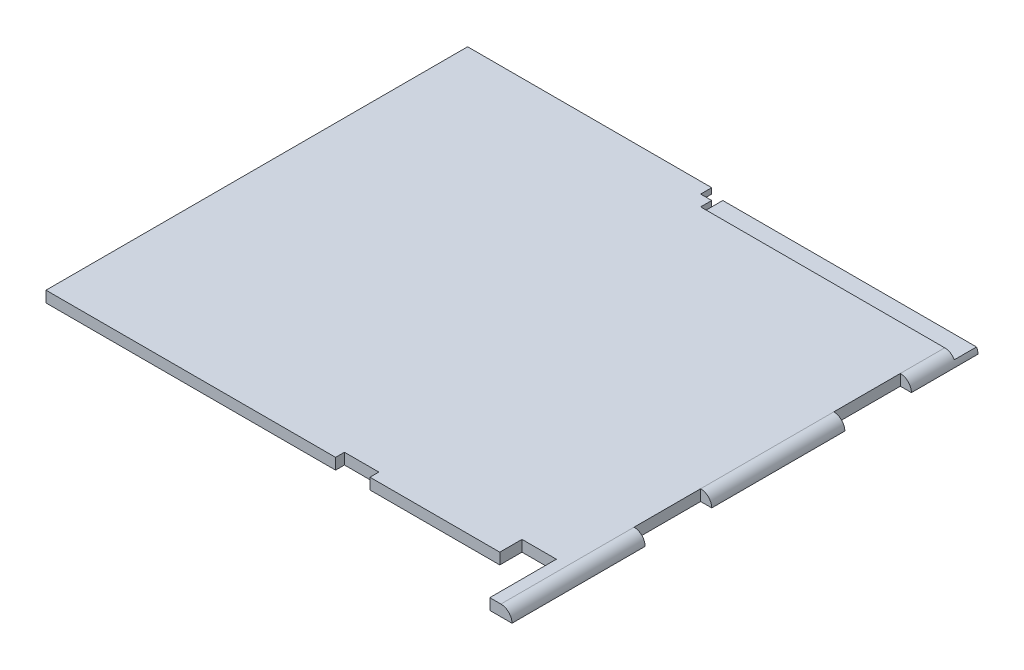
from build123d import *

# Parameters (mm, degrees)
SKETCH_1_W          = 5
SKETCH_1_H          = 60
SKETCH_1_W_2        = 30
SKETCH_1_H_2        = 5
SKETCH_1_W_3        = 15
EXTRUDE_1_DEPTH     = 5
FILLET_1_R          = 5
SKETCH_2_W          = 245
SKETCH_2_H          = 125
CUT_EXTRUDE_1_DEPTH = 5
SKETCH_3_W          = 110
SKETCH_3_H          = 2.5
SKETCH_3_W_2        = 115
CUT_EXTRUDE_2_DEPTH = 10
SKETCH_4_W          = 5
SKETCH_4_H          = 5
CUT_EXTRUDE_3_DEPTH = 5


with BuildPart() as part:
    # 草圖1 → 填料-伸長1 (new body)
    with BuildSketch(Plane(origin=(0, 0, 0), x_dir=(1, 0, 0), z_dir=(0, 1, 0))):
        Polygon((198.746286718, -286.464902661), (198.746286718, -256.464902661), (183.246286718, -256.464902661), (183.246286718, -266.464902661), (124.746286718, -266.464902661), (124.746286718, -262.464902661), (109.246286718, -262.464902661), (109.246286718, -266.464902661), (-21.253713282, -266.464902661), (-21.253713282, 38.535097339), (-36.253713282, 38.535097339), (-36.253713282, 43.535097339), (203.746286718, 43.535097339), (203.746286718, -286.464902661), align=None)
        with Locations((206.246286718, -256.464902661)):
            Rectangle(SKETCH_1_W, SKETCH_1_H)
        with Locations((206.246286718, 13.535097339)):
            Rectangle(SKETCH_1_W, SKETCH_1_H)
        with Locations((188.746286718, 46.035097339)):
            Rectangle(SKETCH_1_W_2, SKETCH_1_H_2)
        with Locations((-21.253713282, 46.035097339)):
            Rectangle(SKETCH_1_W_2, SKETCH_1_H_2)
        with Locations((91.246286718, 46.035097339)):
            Rectangle(SKETCH_1_W_3, SKETCH_1_H_2)
        with Locations((76.246286718, 46.035097339)):
            Rectangle(SKETCH_1_W_3, SKETCH_1_H_2)
        with Locations((206.246286718, -166.464902661)):
            Rectangle(SKETCH_1_W, SKETCH_1_H)
        with Locations((206.246286718, -76.464902661)):
            Rectangle(SKETCH_1_W, SKETCH_1_H)
    extrude(amount=EXTRUDE_1_DEPTH)

    # 圓角1
    fillet_1_edges = [part.edges().sort_by_distance(p)[0] for p in [
        (208.746286718, 5, -13.535097339),
        (208.746286718, 5, 76.464902661),
        (208.746286718, 5, 166.464902661),
        (208.746286718, 5, 256.464902661),
    ]]
    fillet(fillet_1_edges, radius=FILLET_1_R - 0.0001)  # a hair under: the kernel refuses the full size

    # 草圖2 → 除料-伸長1 (cut)
    with BuildSketch(Plane(origin=(0, 5, 0), x_dir=(1, 0, 0), z_dir=(0, 1, 0))):
        with Locations((86.246286718, -13.964902661)):
            Rectangle(SKETCH_2_W, SKETCH_2_H)
    extrude(amount=-CUT_EXTRUDE_1_DEPTH, mode=Mode.SUBTRACT)

    # 草圖3 → 除料-伸長2 (cut)
    with BuildSketch(Plane(origin=(0, 0, 76.464902661), x_dir=(-1, 0, 0), z_dir=(0, 0, -1))):
        with Locations((-33.746286718, 1.25)):
            Rectangle(SKETCH_3_W, SKETCH_3_H)
        with Locations((-151.246286718, 3.75)):
            Rectangle(SKETCH_3_W_2, SKETCH_3_H)
    extrude(amount=-CUT_EXTRUDE_2_DEPTH, mode=Mode.SUBTRACT)

    # 草圖4 → 除料-伸長3 (cut)
    with BuildSketch(Plane(origin=(0, 0, 76.464902661), x_dir=(-1, 0, 0), z_dir=(0, 0, -1))):
        with Locations((-91.246286718, 2.5)):
            Rectangle(SKETCH_4_W, SKETCH_4_H)
    extrude(amount=-CUT_EXTRUDE_3_DEPTH, mode=Mode.SUBTRACT)


solid = part.part
